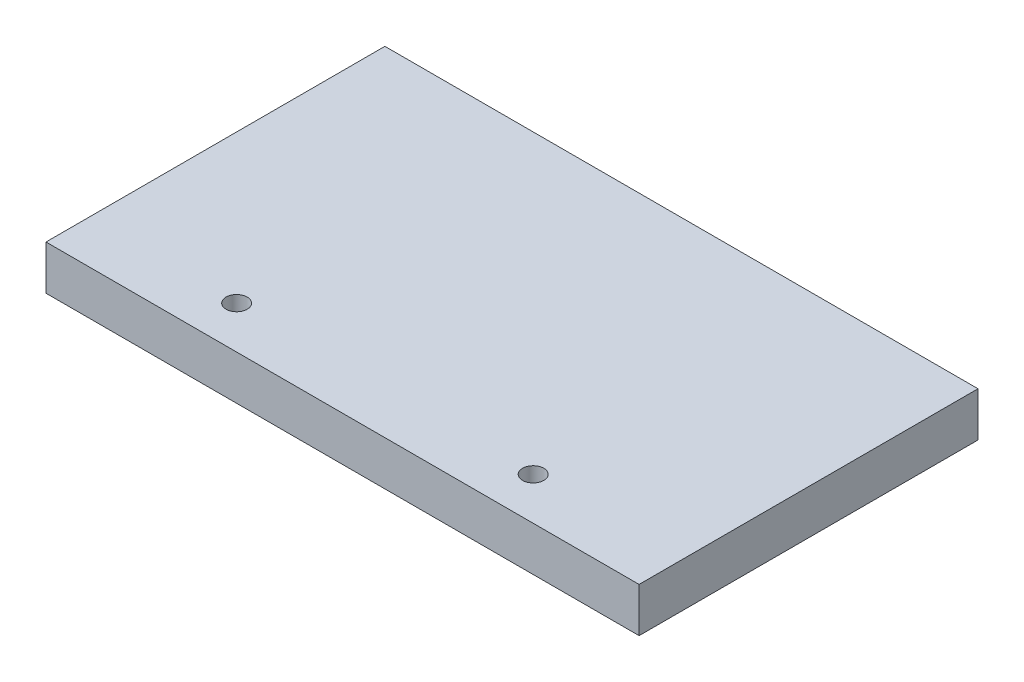
from build123d import *

# Parameters (mm, degrees)
SKETCH1_W           = 88.9
SKETCH1_H           = 50.8
BOSS_EXTRUDE1_DEPTH = 6.6548
SKETCH2_R           = 1.5875
CUT_EXTRUDE1_DEPTH  = 103.606707203


with BuildPart() as part:
    # Sketch1 → Boss-Extrude1 (new body)
    with BuildSketch(Plane(origin=(0, 0, 0), x_dir=(1, 0, 0), z_dir=(0, 1, 0))):
        with Locations((44.45, 25.4)):
            Rectangle(SKETCH1_W, SKETCH1_H)
    extrude(amount=BOSS_EXTRUDE1_DEPTH)

    # Sketch2 → Cut-Extrude1 (cut, through all)
    with BuildSketch(Plane(origin=(0, 6.6548, 0), x_dir=(1, 0, 0), z_dir=(0, 1, 0))):
        with Locations((22.225, 6.35)):
            Circle(SKETCH2_R)
        with Locations((66.675, 6.35)):
            Circle(SKETCH2_R)
    extrude(amount=-CUT_EXTRUDE1_DEPTH, mode=Mode.SUBTRACT)


solid = part.part
